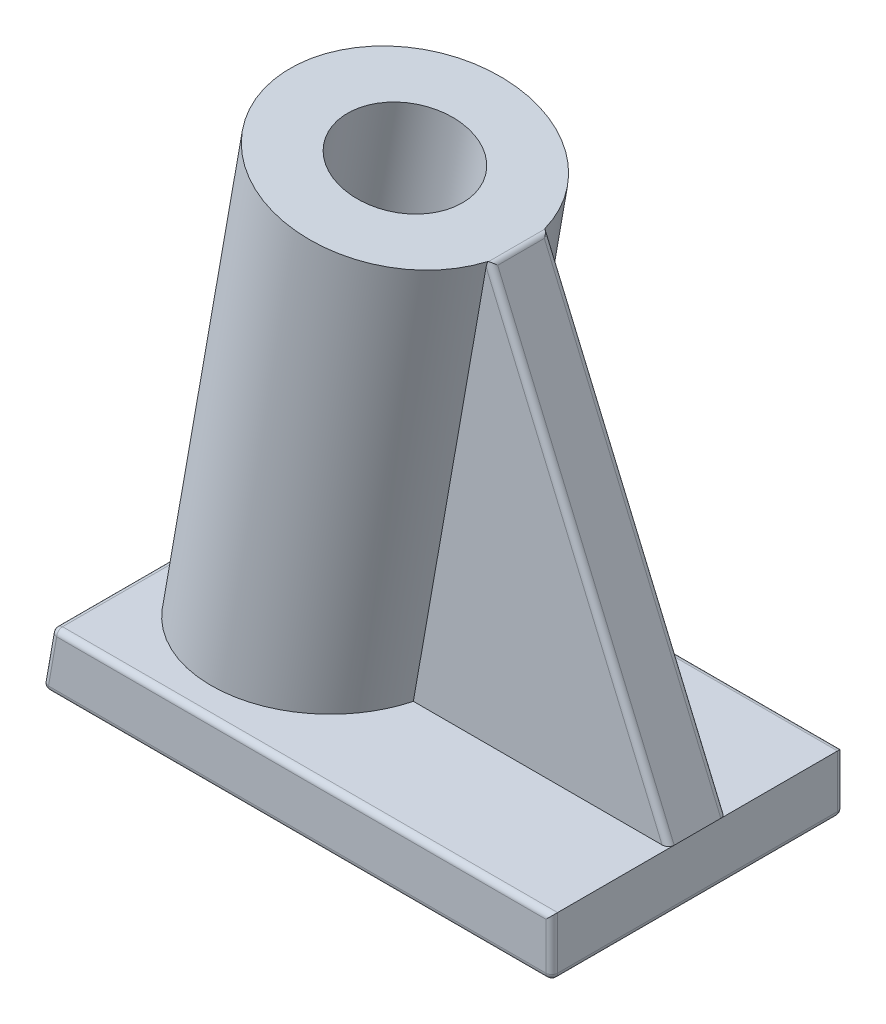
from build123d import *

# Parameters (mm, degrees)
EXTRUDE_1_DEPTH          = 5
EXTRUDE_1_DEPTH_BACK     = 5
EXTRUDE_2_DEPTH          = 2
EXTRUDE_2_DEPTH_BACK     = 2
CUT_EXTRUDE_1_DEPTH      = 2
CUT_EXTRUDE_1_DEPTH_BACK = 2
SKETCH_5_R               = 4
SKETCH_5_R_2             = 2
EXTRUDE_3_DEPTH          = 16
EXTRUDE_4_DEPTH          = 1
EXTRUDE_4_DEPTH_BACK     = 1
CUT_EXTRUDE_2_REACH      = 41.97
CUT_EXTRUDE_START        = -16
SKETCH_7_R               = 2.5
CUT_EXTRUDE_3_REACH      = 25.97
SKETCH_8_R               = 2
FILLET_3_R               = 0.2
FILLET_5_R               = 0.2
FILLET_7_R               = 0.2
FILLET_8_R               = 0.1


with BuildPart() as part:
    # 草图1 → 凸台-拉伸1 (new, two sides: drawn at the far end of the back side and taken through both)
    with BuildSketch(Plane.XY.offset(-EXTRUDE_1_DEPTH_BACK)):
        Polygon((0, 0), (5.5, 0), (5.5, 2), (-11.647346039, 2), (-12, 0), align=None)
    extrude(amount=EXTRUDE_1_DEPTH + EXTRUDE_1_DEPTH_BACK)

    # 草图2 → 凸台-拉伸2 (add, two sides: drawn at the far end of the back side and taken through both)
    with BuildSketch(Plane.XY.offset(-EXTRUDE_2_DEPTH_BACK)):
        with BuildLine():
            Line((-1.5, 0), (1.5, 0))
            Line((1.5, 0), (1.5, -0.677124344))
            ThreePointArc((1.5, -0.677124344), (1.780042303, -1.088161527), (1.95, -1.555590279))
            Line((1.95, -1.555590279), (1.95, -2.5))
            Line((1.95, -2.5), (-1.95, -2.5))
            Line((-1.95, -2.5), (-1.95, -1.555590279))
            ThreePointArc((-1.95, -1.555590279), (-1.780042303, -1.088161527), (-1.5, -0.677124344))
            Line((-1.5, -0.677124344), (-1.5, 0))
        make_face()
    extrude(amount=EXTRUDE_2_DEPTH + EXTRUDE_2_DEPTH_BACK)

    # 草图3 → 切除-拉伸1 (cut, two sides: drawn at the far end of the back side and taken through both)
    with BuildSketch(Plane(origin=(0, 0, 0), x_dir=(0, 0, -1), z_dir=(1, 0, 0)).offset(-CUT_EXTRUDE_1_DEPTH_BACK)):
        with BuildLine():
            Line((1.5, 0), (1.5, -0.677124344))
            ThreePointArc((1.5, -0.677124344), (1.780042303, -1.088161527), (1.95, -1.555590279))
            Line((1.95, -1.555590279), (1.95, -2.5))
            Line((1.95, -2.5), (2, -2.5))
            Line((2, -2.5), (2, 0))
            Line((2, 0), (1.5, 0))
        make_face()
        with BuildLine():
            Line((-2, 0), (-1.5, 0))
            Line((-1.5, 0), (-1.5, -0.677124344))
            ThreePointArc((-1.5, -0.677124344), (-1.780042303, -1.088161527), (-1.95, -1.555590279))
            Line((-1.95, -1.555590279), (-1.95, -2.5))
            Line((-1.95, -2.5), (-2, -2.5))
            Line((-2, -2.5), (-2, 0))
        make_face()
    extrude(amount=CUT_EXTRUDE_1_DEPTH + CUT_EXTRUDE_1_DEPTH_BACK, mode=Mode.SUBTRACT)

    # 草图5 → 凸台-拉伸3 (add)
    with BuildSketch(Plane(origin=(-11.647346039, 2, 5), x_dir=(-0.9848077530122089, 0.17364817766692556, 0), z_dir=(-0.17364817766692556, -0.984807753012209, 0))):
        with Locations(Location((-4.4, 5, 0), (0, 0, 180))):
            Circle(SKETCH_5_R)
        with Locations(Location((-4.4, 5, 0), (0, 0, 180))):
            Circle(SKETCH_5_R_2, mode=Mode.SUBTRACT)
    extrude(amount=-EXTRUDE_3_DEPTH)

    # 草图6 → 凸台-拉伸4 (add, two sides: drawn at the far end of the back side and taken through both)
    with BuildSketch(Plane.XY.offset(-EXTRUDE_4_DEPTH_BACK)):
        Polygon((5.5, 2), (-0.596590071, 16.298279356), (-2.0738017, 16.558751622), (-4.640902417, 2), align=None)
    extrude(amount=EXTRUDE_4_DEPTH + EXTRUDE_4_DEPTH_BACK)

    # 切除-拉伸2: up to this plane
    cut_extrude_2_end = Plane(origin=(0, 0, -5), z_dir=(0, -1, 0))
    # 草图7 → 切除-拉伸2 (cut, up to the surface)
    with BuildSketch(Plane(origin=(2.769180529, 15.704803188, 0), x_dir=(0.9848077530122089, -0.17364817766692558, 0), z_dir=(0.17364817766692558, 0.984807753012209, 0)).offset(CUT_EXTRUDE_START), mode=Mode.PRIVATE) as cut_extrude_2_sk1:
        with Locations(Location((-7.417693036, 0, 0), (0, 0, 180))):
            Circle(SKETCH_7_R)
    cut_extrude_2_tool1 = split(extrude(cut_extrude_2_sk1.sketch, amount=-CUT_EXTRUDE_2_REACH, mode=Mode.PRIVATE), bisect_by=cut_extrude_2_end, keep=Keep.BOTH, mode=Mode.PRIVATE)
    add(cut_extrude_2_tool1.solids().sort_by_distance((-7.314192, 1.235948, 0))[0], mode=Mode.SUBTRACT)

    # 草图8 → 切除-拉伸3 (cut, up to next)
    with BuildSketch(Plane(origin=(2.769180529, 15.704803188, 0), x_dir=(0.9848077530122089, -0.17364817766692558, 0), z_dir=(0.17364817766692558, 0.984807753012209, 0)), mode=Mode.PRIVATE) as cut_extrude_3_sk1:
        with Locations((-7.417693036, 0)):
            Circle(SKETCH_8_R)
    cut_extrude_3_tool1 = extrude(cut_extrude_3_sk1.sketch, amount=-CUT_EXTRUDE_3_REACH, mode=Mode.PRIVATE) & part.part
    add(cut_extrude_3_tool1.solids().sort_by_distance((-4.535821, 16.992872, 0))[0], mode=Mode.SUBTRACT)

    # 圆角3
    fillet_3_edges = [part.edges().sort_by_distance(p)[0] for p in [
        (5.5, 1, -5),
        (-3.073673019, 2, -5),
        (-3.25, 0, 5),
        (5.5, 1, 5),
        (-11.823673019, 1, -5),
        (-3.073673019, 2, 5),
        (-11.823673019, 1, 5),
        (-3.25, 0, -5),
        (-12, 0, 0),
        (-11.647346039, 2, 0),
    ]]
    fillet(fillet_3_edges, radius=FILLET_3_R)

    # 圆角5
    # the kernel refuses this fillet: 0.2 mm, written as the material it takes off along each edge
    with BuildSketch(Plane(origin=(5.3, 0.2, 4.8), x_dir=(1, 0, 0), z_dir=(0, -1, 0))) as fillet_5_piece_1_section:
        Polygon((0, 0), (FILLET_5_R, 0), (FILLET_5_R, FILLET_5_R), (0, FILLET_5_R), align=None)
    fillet_5_piece_1 = extrude(amount=FILLET_5_R, mode=Mode.PRIVATE)
    fillet_5_piece_1 = fillet_5_piece_1 - Plane(origin=(5.3, 0.2, 4.8), x_dir=(-0.7071067811865475, 0, -0.7071067811865475), z_dir=(0, -1, 0)) * Sphere(FILLET_5_R, mode=Mode.PRIVATE)
    add(fillet_5_piece_1, mode=Mode.SUBTRACT)
    with BuildSketch(Plane(origin=(5.3, 0.2, -4.8), x_dir=(1, 0, 0), z_dir=(0, -1, 0))) as fillet_5_piece_2_section:
        Polygon((0, 0), (FILLET_5_R, 0), (FILLET_5_R, -FILLET_5_R), (0, -FILLET_5_R), align=None)
    fillet_5_piece_2 = extrude(amount=FILLET_5_R, mode=Mode.PRIVATE)
    fillet_5_piece_2 = fillet_5_piece_2 - Plane(origin=(5.3, 0.2, -4.8), x_dir=(-0.7071067811865475, 0, 0.7071067811865475), z_dir=(0, -1, 0)) * Sphere(FILLET_5_R, mode=Mode.PRIVATE)
    add(fillet_5_piece_2, mode=Mode.SUBTRACT)
    with BuildSketch(Plane(origin=(5.5, 0, -4.8), x_dir=(-1, 0, 0), z_dir=(0, 0, 1))) as fillet_5_piece_3:
        with BuildLine():
            CenterArc((FILLET_5_R, -FILLET_5_R), FILLET_5_R, 90, 90)
            Line((0, -FILLET_5_R), (0, 0))
            Line((0, 0), (FILLET_5_R, 0))
        make_face()
    extrude(amount=9.6, mode=Mode.SUBTRACT)

    # 圆角7
    # the kernel refuses this fillet: 0.2 mm, written as the material it takes off along each edge
    with BuildSketch(Plane(origin=(-0.596590071, 16.298279356, -1.270954164), x_dir=(0.39222047204702226, -0.9198712417002779, 0), z_dir=(0, 0, 1))) as fillet_7_piece_1:
        with BuildLine():
            CenterArc((FILLET_7_R * 0.541908328714, -FILLET_7_R), FILLET_7_R, 90, 56.907265605)
            Line((-FILLET_7_R * 0.295879631671, -FILLET_7_R * 0.454004273429), (0, 0))
            Line((0, 0), (FILLET_7_R * 0.541908328714, 0))
        make_face()
    extrude(amount=2.541908329, mode=Mode.SUBTRACT)
    with BuildSketch(Plane(origin=(5.696110236, 1.540064379, -1), x_dir=(0, 0, 1), z_dir=(-0.39222047204701954, 0.9198712417002791, 0))) as fillet_7_piece_2_section:
        with BuildLine():
            CenterArc((FILLET_7_R, -FILLET_7_R), FILLET_7_R, 90, 90)
            Line((0, -FILLET_7_R), (0, 0))
            Line((0, 0), (FILLET_7_R, 0))
        make_face()
    fillet_7_piece_2 = extrude(amount=16.543783421, mode=Mode.PRIVATE)
    fillet_7_piece_2 = split(fillet_7_piece_2, bisect_by=Plane(origin=(2.402045939, 2, -0.955327029), z_dir=(0, 1, 0)), keep=Keep.TOP, mode=Mode.PRIVATE)
    fillet_7_piece_2 = fillet_7_piece_2 - Plane(origin=(-5.66753398, 10.574609288, 0), x_dir=(0.984807753012209, -0.17364817766692556, 0), z_dir=(-0.17364817766692556, -0.984807753012209, 0)) * Cylinder(4, 34, mode=Mode.PRIVATE)
    add(fillet_7_piece_2, mode=Mode.SUBTRACT)
    with BuildSketch(Plane(origin=(5.696110236, 1.540064379, 1), x_dir=(0, 0, -1), z_dir=(-0.39222047204701954, 0.9198712417002791, 0))) as fillet_7_piece_3_section:
        with BuildLine():
            CenterArc((FILLET_7_R, FILLET_7_R), FILLET_7_R, 180, 90)
            Line((0, FILLET_7_R), (0, 0))
            Line((0, 0), (FILLET_7_R, 0))
        make_face()
    fillet_7_piece_3 = extrude(amount=16.543783421, mode=Mode.PRIVATE)
    fillet_7_piece_3 = split(fillet_7_piece_3, bisect_by=Plane(origin=(2.402045936, 2, 0.955327029), z_dir=(0, 1, 0)), keep=Keep.TOP, mode=Mode.PRIVATE)
    fillet_7_piece_3 = fillet_7_piece_3 - Plane(origin=(-5.667533979, 10.574609294, 0), x_dir=(0.984807753012209, -0.17364817766692556, 0), z_dir=(-0.17364817766692556, -0.984807753012209, 0)) * Cylinder(4, 34, mode=Mode.PRIVATE)
    add(fillet_7_piece_3, mode=Mode.SUBTRACT)

    # 圆角8
    fillet_8_edges = [part.edges().sort_by_distance(p)[0] for p in [
        (0, -2.5, 1.95),
        (1.95, -2.5, 0),
        (-1.95, -2.5, 0),
        (0, -2.5, -1.95),
    ]]
    fillet(fillet_8_edges, radius=FILLET_8_R)


solid = part.part
